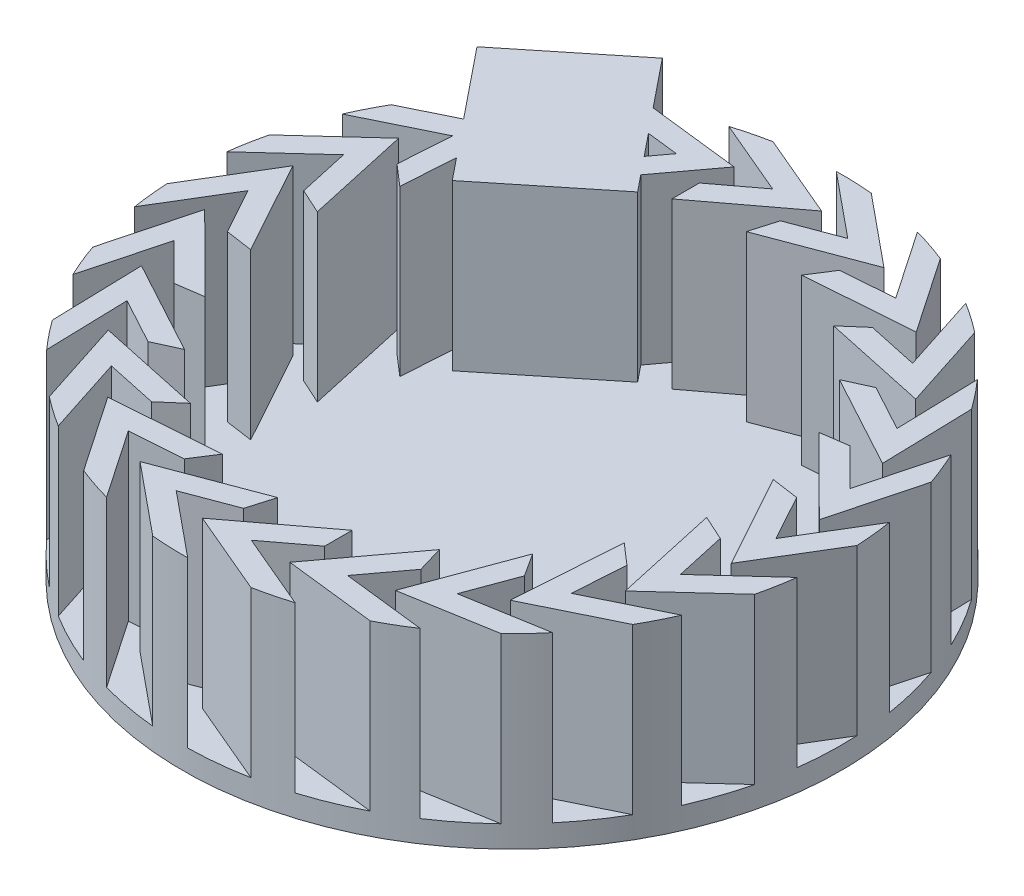
from build123d import *
from build123d.topology import SkipClean

# Parameters (mm, degrees)
SKETCH2_R                = 30
BOSS_EXTRUDE1_DEPTH      = 2
BOSS_EXTRUDE2_DEPTH      = 15
CIRPATTERN1_COUNT        = 22
BOSS_EXTRUDE6_DEPTH      = 15
BOSS_EXTRUDE6_DEPTH_BACK = 2


with BuildPart() as part:
    # Sketch2 → Boss-Extrude1 (new body)
    with BuildSketch(Plane(origin=(0, 0, 0), x_dir=(1, 0, 0), z_dir=(0, 1, 0))):
        Circle(SKETCH2_R)
    extrude(amount=BOSS_EXTRUDE1_DEPTH)

    # Sketch3 → Boss-Extrude2 (add)
    with SkipClean():  # the faces are left unmerged after this step: merging them gives an invalid solid
        with BuildSketch(Plane(origin=(0, 2, 0), x_dir=(1, 0, 0), z_dir=(0, 1, 0))):
            with BuildLine():
                Line((-1.985092303, 25.712553406), (-8.90227869, 28.648724826))
                ThreePointArc((-8.90227869, 28.648724826), (-7.305315088, 29.096947803), (-5.686019978, 29.456224755))
                Line((-5.686019978, 29.456224755), (1.985092303, 26.200030779))
                Line((1.985092303, 26.200030779), (-5.787269057, 20.343136397))
                Line((-5.787269057, 20.343136397), (-5.787269057, 22.847407714))
                Line((-5.787269057, 22.847407714), (-1.985092303, 25.712553406))
            make_face()
        boss_extrude2 = extrude(amount=BOSS_EXTRUDE2_DEPTH)

    # CirPattern1: Boss-Extrude2 ×22 about axis
    with SkipClean():  # the faces are left unmerged after this step: merging them gives an invalid solid
        cirpattern1_axis = Axis((0, 2, 0), (0, 1, 0))
        for i in range(1, CIRPATTERN1_COUNT):
            add(boss_extrude2.rotate(cirpattern1_axis, i * 360 / CIRPATTERN1_COUNT))

    # Sketch8 → Boss-Extrude6 (add, two sides: drawn at the far end of the back side and taken through both)
    with SkipClean():  # the faces are left unmerged after this step: merging them gives an invalid solid
        with BuildSketch(Plane(origin=(0, 2, 0), x_dir=(1, 0, 0), z_dir=(0, 1, 0)).offset(-BOSS_EXTRUDE6_DEPTH_BACK)):
            Polygon((-12.562522942, 15.562230474), (-7.893853799, 19.330987357), (-17.315746006, 31.002660213), (-26.65308429, 23.465146448), (-17.231192084, 11.793473592), align=None)
        extrude(amount=BOSS_EXTRUDE6_DEPTH + BOSS_EXTRUDE6_DEPTH_BACK)


solid = part.part
